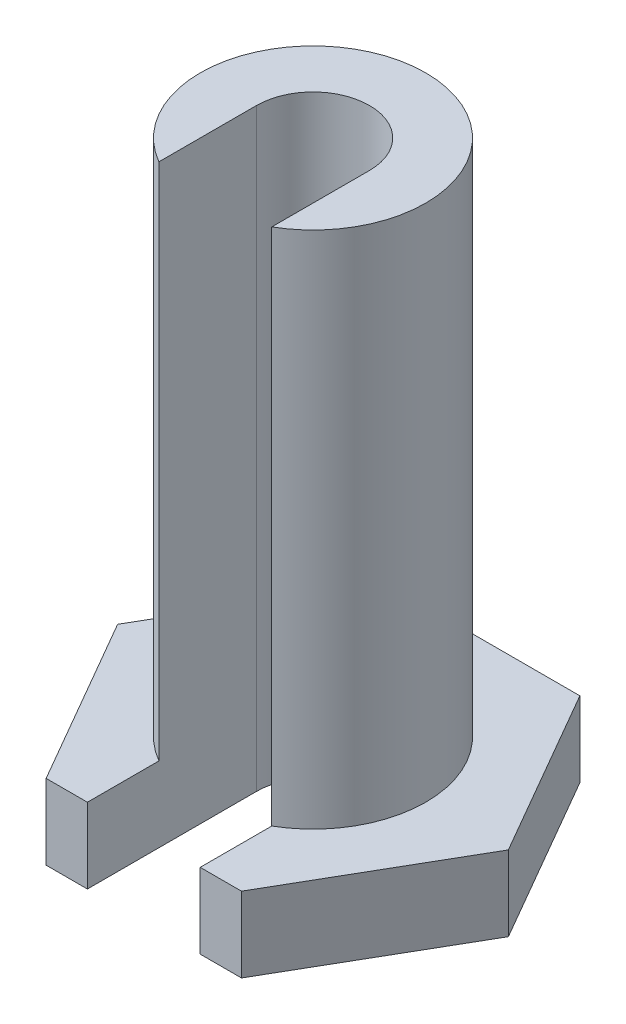
from build123d import *

# Parameters (mm, degrees)
SKETCH1_R               = 3
BOSS_EXTRUDE1_DEPTH     = 15.8
BOSS_EXTRUDE2_DEPTH     = 2
CUT_EXTRUDE1_DEPTH      = 18.23049622
CUT_EXTRUDE1_DEPTH_BACK = 18.23049622


with BuildPart() as part:
    # Sketch1 → Boss-Extrude1 (new body)
    with BuildSketch(Plane(origin=(0, 0, 0), x_dir=(1, 0, 0), z_dir=(0, 1, 0))):
        Circle(SKETCH1_R)
    extrude(amount=BOSS_EXTRUDE1_DEPTH)

    # Sketch3 → Boss-Extrude2 (add)
    with BuildSketch(Plane(origin=(0, 0, 0), x_dir=(-1, 0, 0), z_dir=(0, -1, 0))):
        Polygon((5.196152423, 0), (2.598076211, 4.5), (-2.598076211, 4.5), (-5.196152423, 0), (-2.598076211, -4.5), (2.598076211, -4.5), align=None)
    extrude(amount=-BOSS_EXTRUDE2_DEPTH)

    # Sketch4 → Cut-Extrude1 (cut, two sides: drawn at the far end of the back side and taken through both)
    with BuildSketch(Plane(origin=(0, 15.8, 0), x_dir=(1, 0, 0), z_dir=(0, 1, 0)).offset(-CUT_EXTRUDE1_DEPTH_BACK)):
        with BuildLine():
            Line((-1.5, 0), (-1.5, -4.5))
            Line((-1.5, -4.5), (1.5, -4.5))
            Line((1.5, -4.5), (1.5, 0))
            ThreePointArc((1.5, 0), (0, 1.5), (-1.5, 0))
        make_face()
    extrude(amount=CUT_EXTRUDE1_DEPTH + CUT_EXTRUDE1_DEPTH_BACK, mode=Mode.SUBTRACT)


solid = part.part
